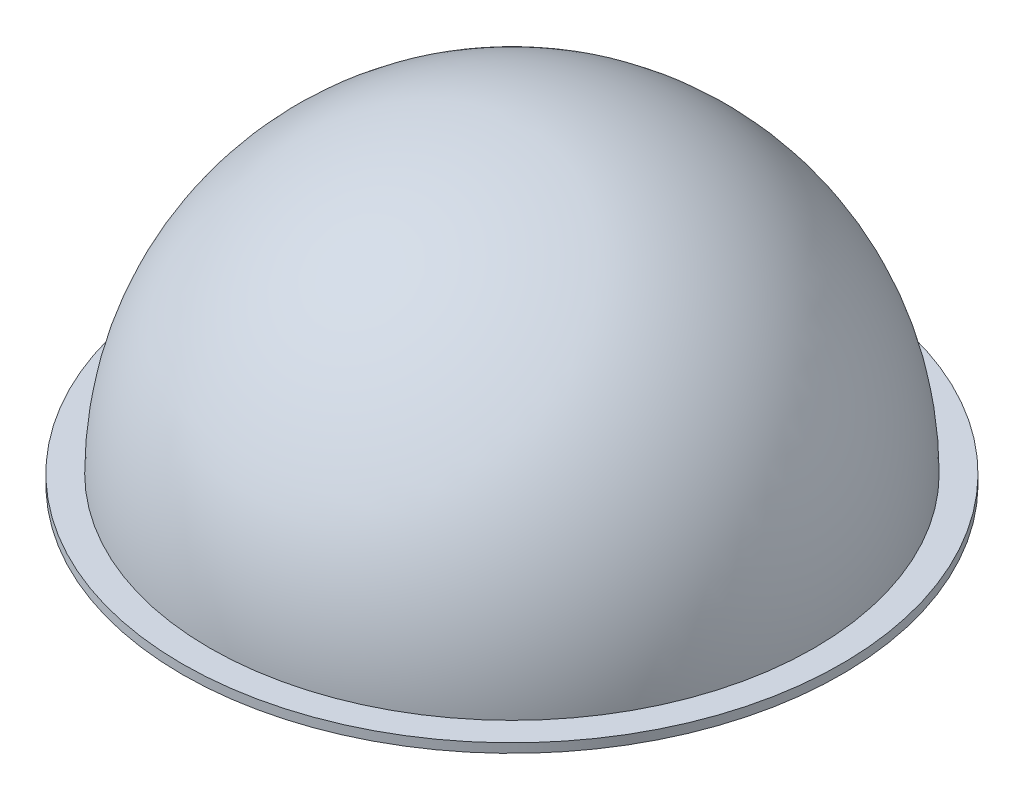
from build123d import *


with BuildPart() as part:
    # Sketch1 → Revolve1 (revolve)
    with BuildSketch(Plane.XY):
        with BuildLine():
            Line((0, 49.5), (0, 48))
            ThreePointArc((0, 48), (33.941125497, 33.941125497), (48, 0))
            Line((48, 0), (48, -1.5))
            Line((48, -1.5), (54, -1.5))
            Line((54, -1.5), (54, 0))
            Line((54, 0), (49.5, 0))
            ThreePointArc((49.5, 0), (35.001785669, 35.001785669), (0, 49.5))
        make_face()
    revolve(axis=Axis((0, 49.5, 0), (0, -1, 0)))


solid = part.part
